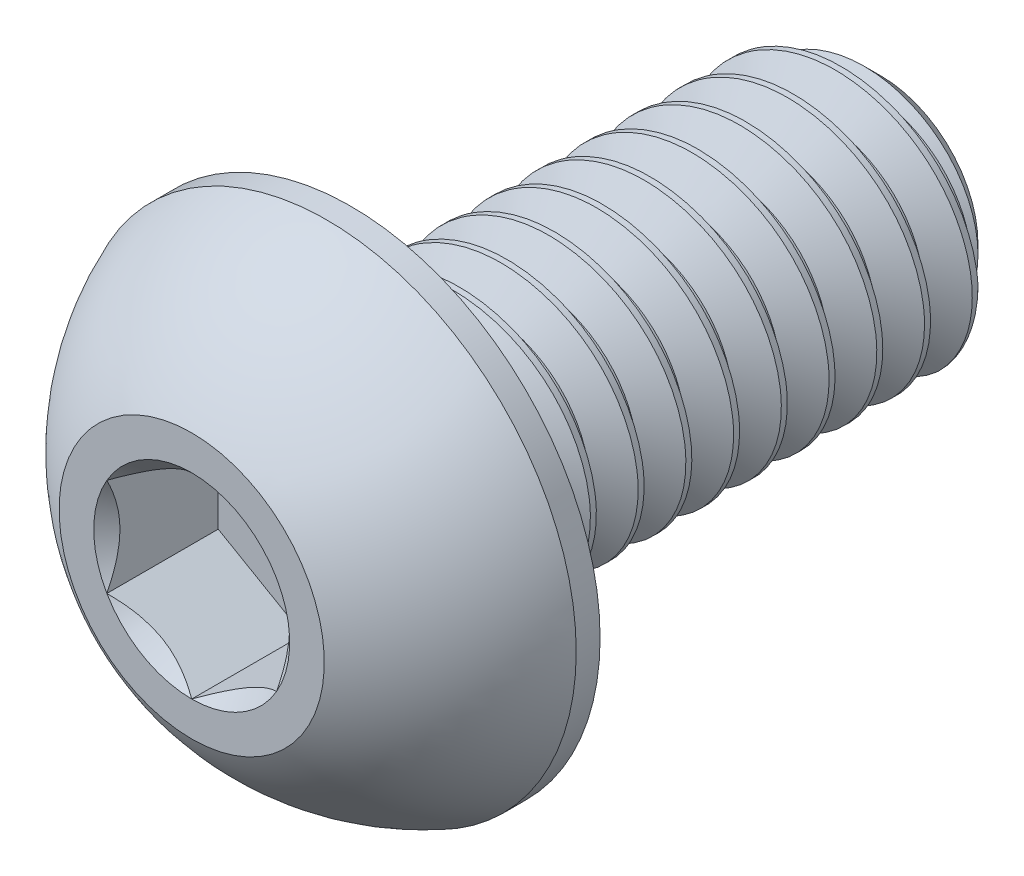
from build123d import *

# Parameters (mm, degrees)
SKETCH1_W          = 5
SKETCH1_H          = 1.25
CHAMFER1_SIZE      = 0.3375
CUT_SWEEP1_PITCH   = 0.45
CUT_EXTRUDE2_DEPTH = 1.05


with BuildPart() as part:
    # Sketch1 → Revolve1 (revolve)
    with BuildSketch(Plane(origin=(0, 0, 0), x_dir=(0, 0, -1), z_dir=(1, 0, 0))):
        with Locations((4, 0.625)):
            Rectangle(SKETCH1_W, SKETCH1_H)
    revolve(axis=Axis((0, 0, -6.5), (0, 0, 1)))

    # Chamfer1
    chamfer1_edges = [part.edges().sort_by_distance(p)[0] for p in [
        (0, -1.25, -6.5),
    ]]
    chamfer(chamfer1_edges, length=CHAMFER1_SIZE)

    # Cut-Sweep1: the profile of Sketch2 profile screwed along a right-hand helix of 12.111111 turns, 6 arcs to a turn; built about Z, then put on its axis
    cut_sweep1_z = Axis((0, 0, 0), (0, 0, 1))
    cut_sweep1_corners = [(1.2503, 0, 0.000173205), (1.2503, 0, -0.393923205), (0.957716426, 0, -0.225), (0.957716426, 0, -0.16875)]
    with BuildLine(mode=Mode.PRIVATE) as cut_sweep1_profile:
        Line(cut_sweep1_corners[0], cut_sweep1_corners[1])
        Line(cut_sweep1_corners[1], cut_sweep1_corners[2])
        Line(cut_sweep1_corners[2], cut_sweep1_corners[3])
        Line(cut_sweep1_corners[3], cut_sweep1_corners[0])
    cut_sweep1_cap = Face(cut_sweep1_profile.wire())
    cut_sweep1_turn_angles = [0, 30, 60, 90, 120, 150, 180, 210, 240, 270, 300, 330, 360]
    cut_sweep1_turn_weights = [1, 0.8660254037844387, 1, 0.8660254037844387, 1, 0.8660254037844387, 1, 0.8660254037844387, 1, 0.8660254037844387, 1, 0.8660254037844387, 1]
    cut_sweep1_turn_rails = [Edge.make_bspline([Vector(p[0], p[1], 0).rotate(cut_sweep1_z, cut_sweep1_turn_angles[k]) / cut_sweep1_turn_weights[k] + Vector(0, 0, p[2] + CUT_SWEEP1_PITCH * cut_sweep1_turn_angles[k] / 360) for k in range(13)], [0, 0, 0, 1, 1, 2, 2, 3, 3, 4, 4, 5, 5, 6, 6, 6], 2, cut_sweep1_turn_weights) for p in cut_sweep1_corners]
    cut_sweep1_turn_sides = [Face.make_surface_from_curves(cut_sweep1_turn_rails[p[0]], cut_sweep1_turn_rails[p[1]]) for p in [(0, 1), (1, 2), (2, 3), (3, 0)]]
    cut_sweep1_last_angles = [4320, 4340, 4360]
    cut_sweep1_last_weights = [1, 0.9396926207858893, 1]
    cut_sweep1_last_rails = [Edge.make_bspline([Vector(p[0], p[1], 0).rotate(cut_sweep1_z, cut_sweep1_last_angles[k]) / cut_sweep1_last_weights[k] + Vector(0, 0, p[2] + CUT_SWEEP1_PITCH * cut_sweep1_last_angles[k] / 360) for k in range(3)], [0, 0, 0, 1, 1, 1], 2, cut_sweep1_last_weights) for p in cut_sweep1_corners]
    cut_sweep1_last_sides = [Face.make_surface_from_curves(cut_sweep1_last_rails[p[0]], cut_sweep1_last_rails[p[1]]) for p in [(0, 1), (1, 2), (2, 3), (3, 0)]]
    cut_sweep1 = Plane(origin=(0, 0, -6.5), x_dir=(0, 1, 0), z_dir=(0, 0, 1)) * Solid(Shell([*[p.moved(Location((0, 0, CUT_SWEEP1_PITCH * i))) for i in range(12) for p in cut_sweep1_turn_sides], *cut_sweep1_last_sides, cut_sweep1_cap, cut_sweep1_cap.rotate(cut_sweep1_z, 4360).moved(Location((0, 0, CUT_SWEEP1_PITCH * 4360 / 360)))]))
    add(cut_sweep1, mode=Mode.SUBTRACT)

    # Sketch7 → Revolve2 (revolve)
    with BuildSketch(Plane(origin=(0, 0, 0), x_dir=(0, 0, -1), z_dir=(1, 0, 0)), mode=Mode.PRIVATE) as revolve2_sk:
        with BuildLine():
            Line((1.275, 2.35), (1.5, 2.35))
            Line((1.5, 2.35), (1.5, 0))
            Line((1.5, 0), (0, 0))
            Line((0, 0), (0, 1.25))
            ThreePointArc((0, 1.25), (0.542980616, 1.909556558), (1.275, 2.35))
        make_face()
    revolve(revolve2_sk.sketch.rotate(Axis((0, 0, 0), (0, 0, -1)), 189.336081704), axis=Axis((0, 0, 0), (0, 0, -1)))

    # Sketch5 → Cut-Extrude2 (cut)
    with BuildSketch(Plane.XY):
        Polygon((0.8, -0.461880215), (0.8, 0.461880215), (0, 0.923760431), (-0.8, 0.461880215), (-0.8, -0.461880215), (0, -0.923760431), align=None)
    extrude(amount=-CUT_EXTRUDE2_DEPTH, mode=Mode.SUBTRACT)

    # Cut-Extrude3 cone 1 section (through the dimple's axis) → Cut-Extrude3 (revolve, cut)
    with BuildSketch(Plane(origin=(0, 0, 0), x_dir=(0, -1, 0), z_dir=(1, 0, 0))):
        Polygon((0, 0), (0.923760431, 0), (0, 0.923760431), align=None)
    revolve(axis=Axis((0, 0, 0), (0, 0, -1)), mode=Mode.SUBTRACT)


solid = part.part
